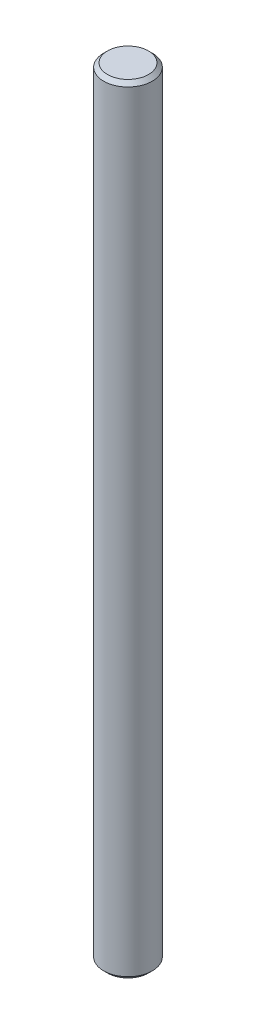
from build123d import *

# Parameters (mm, degrees)
BAR_FACE_R        = 3.175
BAR_EXTRUDE_DEPTH = 101.6
CHAMFER2_SIZE     = 0.5


with BuildPart() as part:
    # Bar face → Bar extrude (new body)
    with BuildSketch(Plane(origin=(0, 0, 0), x_dir=(1, 0, 0), z_dir=(0, 1, 0))):
        Circle(BAR_FACE_R)
    extrude(amount=BAR_EXTRUDE_DEPTH)

    # Chamfer2
    chamfer2_edges = [part.edges().sort_by_distance(p)[0] for p in [
        (-3.175, 101.6, 0),
        (-3.175, 0, 0),
    ]]
    chamfer(chamfer2_edges, length=CHAMFER2_SIZE)


solid = part.part
